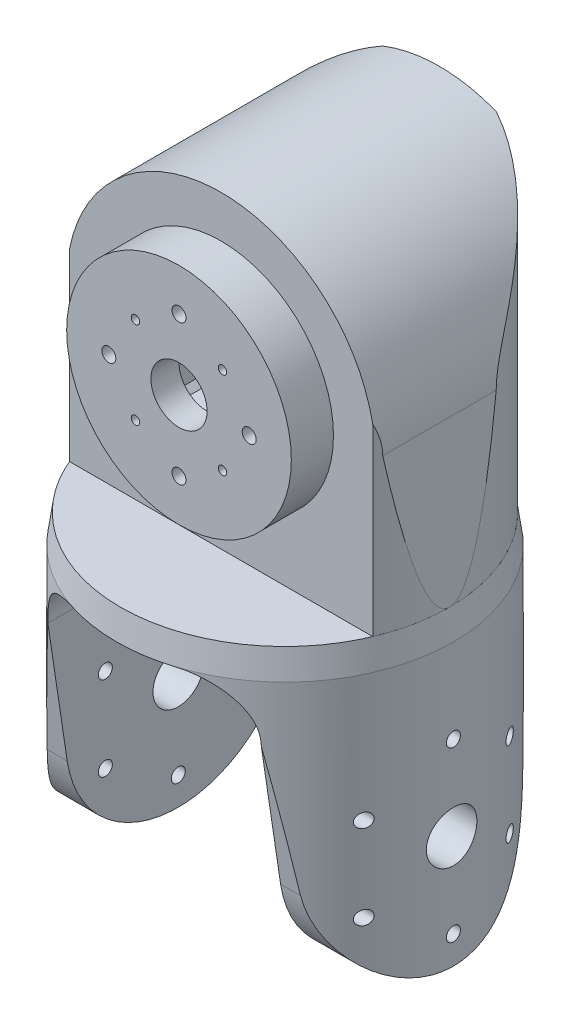
from build123d import *

# Parameters (mm, degrees)
SKETCH1_R               = 60
BOSS_EXTRUDE2_DEPTH     = 40
BOSS_EXTRUDE2_TAPER     = 8
SKETCH3_R               = 60
BOSS_EXTRUDE4_DEPTH     = 100
CUT_EXTRUDE2_START      = -100
CUT_EXTRUDE2_DEPTH      = 100
FILLET1_R               = 20
CUT_EXTRUDE3_DEPTH      = 200
CUT_EXTRUDE3_DEPTH_BACK = 80
CUT_EXTRUDE5_DEPTH      = 153.328592364
CUT_EXTRUDE5_DEPTH_BACK = 153.328592364
SKETCH9_R               = 2.5
SKETCH9_R_2             = 9
SKETCH10_R              = 60
CUT_EXTRUDE7_DEPTH      = 30
SKETCH12_R              = 55
BOSS_EXTRUDE5_DEPTH     = 55
SKETCH13_R              = 82.5
SKETCH13_R_2            = 58.594591653
CUT_EXTRUDE9_DEPTH      = 110
CUT_EXTRUDE10_DEPTH     = 110
SKETCH15_R              = 40
BOSS_EXTRUDE6_DEPTH     = 15
SKETCH16_R              = 1.5
SKETCH16_R_2            = 10
CUT_EXTRUDE11_DEPTH     = 166.994117465
CUT_EXTRUDE12_DEPTH     = 82.744805363
SKETCH18_R              = 2.5
CUT_EXTRUDE13_DEPTH     = 166.994117465


with BuildPart() as part:
    # Sketch1 → Boss-Extrude2 (new body)
    with BuildSketch(Plane(origin=(0, 0, 0), x_dir=(1, 0, 0), z_dir=(0, 1, 0))):
        Circle(SKETCH1_R)
    extrude(amount=BOSS_EXTRUDE2_DEPTH, taper=BOSS_EXTRUDE2_TAPER)

    # Sketch3 → Boss-Extrude4 (add)
    with BuildSketch(Plane.XZ):
        with Locations(Location((0, 0, 0), (0, 0, 90))):
            Circle(SKETCH3_R)
    extrude(amount=BOSS_EXTRUDE4_DEPTH)

    # Sketch4 → Cut-Extrude2 (cut)
    with BuildSketch(Plane.XZ.offset(100).offset(CUT_EXTRUDE2_START)):
        with BuildLine():
            Line((38, -46.432747065), (38, 46.432747065))
            ThreePointArc((38, 46.432747065), (0, 60), (-38, 46.432747065))
            Line((-38, 46.432747065), (-38, -46.432747065))
            ThreePointArc((-38, -46.432747065), (0, -60), (38, -46.432747065))
        make_face()
    extrude(amount=CUT_EXTRUDE2_DEPTH, mode=Mode.SUBTRACT)

    # Fillet1
    # the kernel refuses this fillet: 20 mm, written as the material it adds along each edge
    with BuildSketch(Plane(origin=(38, 0, -96.432747065), x_dir=(-1, 0, 0), z_dir=(0, 0, 1))) as fillet1_piece_1_section:
        with BuildLine():
            CenterArc((FILLET1_R, FILLET1_R), FILLET1_R, 180, 90)
            Line((0, FILLET1_R), (0, 0))
            Line((0, 0), (FILLET1_R, 0))
        make_face()
    fillet1_piece_1 = extrude(amount=192.86549413, mode=Mode.PRIVATE)
    fillet1_piece_1 = fillet1_piece_1 & Plane(origin=(0, -4.359340231, 0), x_dir=(0, 0, 1), z_dir=(0, 1, 0)) * Cylinder(60, 466, mode=Mode.PRIVATE)
    add(fillet1_piece_1)
    with BuildSketch(Plane(origin=(-38, 0, 96.432747065), x_dir=(0, -1, 0), z_dir=(0, 0, -1))) as fillet1_piece_2_section:
        with BuildLine():
            CenterArc((FILLET1_R, -FILLET1_R), FILLET1_R, 90, 90)
            Line((0, -FILLET1_R), (0, 0))
            Line((0, 0), (FILLET1_R, 0))
        make_face()
    fillet1_piece_2 = extrude(amount=192.86549413, mode=Mode.PRIVATE)
    fillet1_piece_2 = fillet1_piece_2 & Plane(origin=(0, -4.359340485, 0), x_dir=(0, 0, 1), z_dir=(0, 1, 0)) * Cylinder(60, 466, mode=Mode.PRIVATE)
    add(fillet1_piece_2)

    # Sketch5 → Cut-Extrude3 (cut, two sides: drawn at the far end of the back side and taken through both)
    with BuildSketch(Plane(origin=(-38, 0, 0), x_dir=(0, 0, -1), z_dir=(1, 0, 0)).offset(-CUT_EXTRUDE3_DEPTH_BACK)):
        with BuildLine():
            Line((-39.559315923, -65.921192758), (-46.432747065, -20))
            Line((-46.432747065, -20), (-46.432747065, -100))
            Line((-46.432747065, -100), (0, -100))
            ThreePointArc((0, -100), (-26.107013327, -90.30550866), (-39.559315923, -65.921192758))
        make_face()
        with BuildLine():
            ThreePointArc((39.559315923, -65.921192758), (26.107013327, -90.30550866), (0, -100))
            Line((0, -100), (46.432747065, -100))
            Line((46.432747065, -100), (46.432747065, -20))
            Line((46.432747065, -20), (39.559315923, -65.921192758))
        make_face()
    extrude(amount=CUT_EXTRUDE3_DEPTH + CUT_EXTRUDE3_DEPTH_BACK, mode=Mode.SUBTRACT)

    # Sketch9 → Cut-Extrude5 (cut, two sides: drawn at the far end of the back side and taken through both)
    with BuildSketch(Plane(origin=(-38, 0, 0), x_dir=(0, 0, -1), z_dir=(1, 0, 0)).offset(-CUT_EXTRUDE5_DEPTH_BACK)):
        with Locations((25.980762114, -45)):
            Circle(SKETCH9_R)
        with Locations((25.980762114, -75)):
            Circle(SKETCH9_R)
        with Locations((0, -30)):
            Circle(SKETCH9_R)
        with Locations((0, -90)):
            Circle(SKETCH9_R)
        with Locations((-25.980762114, -45)):
            Circle(SKETCH9_R)
        with Locations((-25.980762114, -75)):
            Circle(SKETCH9_R)
        with Locations((0, -60)):
            Circle(SKETCH9_R_2)
    extrude(amount=CUT_EXTRUDE5_DEPTH + CUT_EXTRUDE5_DEPTH_BACK, mode=Mode.SUBTRACT)

    # Sketch10 → Cut-Extrude7 (cut)
    with BuildSketch(Plane(origin=(0, 40, 0), x_dir=(1, 0, 0), z_dir=(0, 1, 0))):
        Circle(SKETCH10_R)
    extrude(amount=-CUT_EXTRUDE7_DEPTH, mode=Mode.SUBTRACT)


with BuildPart() as body_2:
    # Sketch12 → Boss-Extrude5 (new, symmetric)
    with BuildSketch(Plane.XY):
        with Locations((0, 65)):
            Circle(SKETCH12_R)
        with BuildLine():
            Line((-55, 65), (-58.594591653, 10))
            Line((-58.594591653, 10), (-1.1e-07, 10))
            ThreePointArc((-1.1e-07, 10), (-38.890873004, 26.109127074), (-55, 65))
        make_face()
        with BuildLine():
            ThreePointArc((55, 65), (38.890872926, 26.109126996), (-1.1e-07, 10))
            Line((-1.1e-07, 10), (58.594591653, 10))
            Line((58.594591653, 10), (55, 65))
        make_face()
    extrude(amount=BOSS_EXTRUDE5_DEPTH, both=True)

    # Sketch13 → Cut-Extrude9 (cut)
    with BuildSketch(Plane.XZ.offset(-10)):
        Circle(SKETCH13_R)
        Circle(SKETCH13_R_2, mode=Mode.SUBTRACT)
    extrude(amount=-CUT_EXTRUDE9_DEPTH, mode=Mode.SUBTRACT)

    # Sketch14 → Cut-Extrude10 (cut)
    with BuildSketch(Plane(origin=(0, 10, 0), x_dir=(1, 0, 0), z_dir=(0, 1, 0))):
        with BuildLine():
            ThreePointArc((-54, -22.744805363), (0, -58.594591653), (54, -22.744805363))
            Line((54, -22.744805363), (-54, -22.744805363))
        make_face()
    extrude(amount=CUT_EXTRUDE10_DEPTH, mode=Mode.SUBTRACT)

    # Sketch15 → Boss-Extrude6 (add)
    with BuildSketch(Plane.XY.offset(22.744805363)):
        with Locations((0, 65)):
            Circle(SKETCH15_R)
    extrude(amount=BOSS_EXTRUDE6_DEPTH)

    # Sketch16 → Cut-Extrude11 (cut, through all)
    with BuildSketch(Plane.XY.offset(37.744805363)):
        with Locations((-15.5, 80.5)):
            Circle(SKETCH16_R)
        with Locations((15.5, 80.5)):
            Circle(SKETCH16_R)
        with Locations((15.5, 49.5)):
            Circle(SKETCH16_R)
        with Locations((-15.5, 49.5)):
            Circle(SKETCH16_R)
        with Locations((0, 65)):
            Circle(SKETCH16_R_2)
    extrude(amount=-CUT_EXTRUDE11_DEPTH, mode=Mode.SUBTRACT)

    # Sketch17 → Cut-Extrude12 (cut)
    with BuildSketch(Plane(origin=(0, 0, -55), x_dir=(-1, 0, 0), z_dir=(0, 0, -1))):
        Polygon((-19, 86), (-21, 84), (-21, 46), (-19, 44), (19, 44), (21, 46), (21, 84), (19, 86), align=None)
    extrude(amount=-CUT_EXTRUDE12_DEPTH, mode=Mode.SUBTRACT)

    # Sketch18 → Cut-Extrude13 (cut, through all)
    with BuildSketch(Plane.XY.offset(37.744805363)):
        with Locations((0, 90)):
            Circle(SKETCH18_R)
        with Locations((25, 65)):
            Circle(SKETCH18_R)
        with Locations((0, 40)):
            Circle(SKETCH18_R)
        with Locations((-25, 65)):
            Circle(SKETCH18_R)
    extrude(amount=-CUT_EXTRUDE13_DEPTH, mode=Mode.SUBTRACT)


solid = Compound([part.part, body_2.part])
